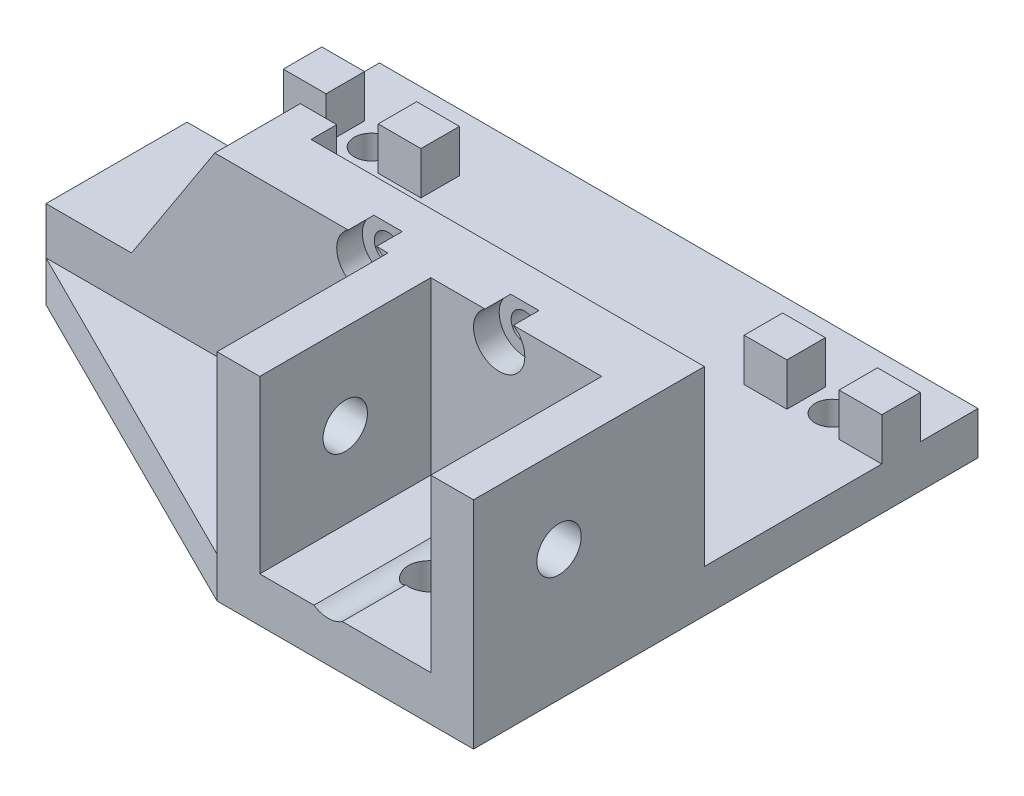
from build123d import *

# Parameters (mm, degrees)
SKETCH1_W            = 40
SKETCH1_H            = 20
SKETCH1_R            = 1.6
BOSS_EXTRUDE1_DEPTH  = 7
BOSS_EXTRUDE2_DEPTH  = 5
BOSS_EXTRUDE3_DEPTH  = 5
BOSS_EXTRUDE4_DEPTH  = 0.25
SKETCH5_W            = 50
SKETCH5_H            = 36
BOSS_EXTRUDE5_DEPTH  = 5
SKETCH6_R            = 3
CUT_EXTRUDE1_DEPTH   = 3
BOSS_EXTRUDE6_DEPTH  = 20
BOSS_EXTRUDE8_DEPTH  = 20
SKETCH10_R           = 2.6
CUT_EXTRUDE2_DEPTH   = 60.779281528
BOSS_EXTRUDE9_DEPTH  = 20
SKETCH12_R           = 2.6
CUT_EXTRUDE3_DEPTH   = 60.190898836
SKETCH13_W           = 5
SKETCH13_H           = 5
CUT_EXTRUDE4_DEPTH   = 6.5
CHAMFER1_SIZE        = 15.398649638
CHAMFER1_SIZE_2      = 10
SKETCH14_W           = 1
SKETCH14_H           = 20.25
CUT_EXTRUDE5_DEPTH   = 10
SKETCH16_W           = 4
SKETCH16_H           = 20.25
CUT_EXTRUDE7_DEPTH   = 10
BOSS_EXTRUDE10_DEPTH = 4.75
SKETCH18_W           = 70
SKETCH18_H           = 5
BOSS_EXTRUDE11_DEPTH = 3
BOSS_EXTRUDE7_DEPTH  = 5
SKETCH15_R           = 2
CUT_EXTRUDE6_DEPTH   = 10


with BuildPart() as part:
    # Sketch1 → Boss-Extrude1 (new body)
    with BuildSketch(Plane.XY):
        Rectangle(SKETCH1_W, SKETCH1_H)
        with Locations((-8, 7.5)):
            Circle(SKETCH1_R, mode=Mode.SUBTRACT)
        with Locations((8, 7.5)):
            Circle(SKETCH1_R, mode=Mode.SUBTRACT)
        with Locations((8, -7.5)):
            Circle(SKETCH1_R, mode=Mode.SUBTRACT)
        with Locations((-8, -7.5)):
            Circle(SKETCH1_R, mode=Mode.SUBTRACT)
    extrude(amount=BOSS_EXTRUDE1_DEPTH)

    # Sketch2 → Boss-Extrude2 (add)
    with BuildSketch(Plane(origin=(20, 0, 0), x_dir=(0, 0, -1), z_dir=(1, 0, 0))):
        Polygon((3, -5), (3, 5), (9.5, 5), (9.5, 10), (0, 10), (-7, 10), (-7, -10), (0, -10), (9.5, -10), (9.5, -5), align=None)
    extrude(amount=BOSS_EXTRUDE2_DEPTH)

    # Sketch3 → Boss-Extrude3 (add)
    with BuildSketch(Plane.ZY.offset(20)):
        Polygon((7, 10), (-9.5, 10), (-9.5, 5), (-3, 5), (-3, -5), (-9.5, -5), (-9.5, -10), (7, -10), align=None)
    extrude(amount=BOSS_EXTRUDE3_DEPTH)

    # Sketch4 → Boss-Extrude4 (add)
    with BuildSketch(Plane.XZ.offset(10)):
        Polygon((-25, 7), (-25, -9.5), (-20, -9.5), (-20, 0), (20, 0), (20, -9.5), (25, -9.5), (25, 7), align=None)
    extrude(amount=BOSS_EXTRUDE4_DEPTH)

    # Sketch5 → Boss-Extrude5 (add)
    with BuildSketch(Plane.XZ.offset(10.25)):
        with Locations((0, -11)):
            Rectangle(SKETCH5_W, SKETCH5_H)
    extrude(amount=BOSS_EXTRUDE5_DEPTH)

    # Sketch6 → Cut-Extrude1 (cut)
    with BuildSketch(Plane.XY.offset(7)):
        with Locations((-8, 7.5)):
            Circle(SKETCH6_R)
        with Locations((-8, -7.5)):
            Circle(SKETCH6_R)
        with Locations((8, -7.5)):
            Circle(SKETCH6_R)
        with Locations((8, 7.5)):
            Circle(SKETCH6_R)
    extrude(amount=-CUT_EXTRUDE1_DEPTH, mode=Mode.SUBTRACT)

    # Sketch7 → Boss-Extrude6 (add)
    with BuildSketch(Plane.ZY.offset(25)):
        Polygon((-3, -5), (7, -5), (7, -15.25), (-29, -15.25), (-29, -10.25), (-9.5, -10.25), (-9.5, -5), align=None)
    extrude(amount=BOSS_EXTRUDE6_DEPTH)

    # Sketch9 → Boss-Extrude8 (add)
    with BuildSketch(Plane.XY.offset(7)):
        Polygon((0, 0), (0, 10), (-5, 10), (-5, -10), (0, -10), align=None)
        Polygon((20, 0), (20, 10), (25, 10), (25, -10), (20, -10), align=None)
    extrude(amount=BOSS_EXTRUDE8_DEPTH)

    # Sketch10 → Cut-Extrude2 (cut, through all)
    with BuildSketch(Plane.ZY.offset(25)):
        with Locations(Location((17, 0, 0), (0, 0, 270))):
            Circle(SKETCH10_R)
    extrude(amount=-CUT_EXTRUDE2_DEPTH, mode=Mode.SUBTRACT)

    # Sketch11 → Boss-Extrude9 (add, through all)
    with BuildSketch(Plane.XY.offset(7)):
        with BuildLine():
            Line((25, -15.25), (25, -10))
            Line((25, -10), (10, -10))
            Line((10, -10), (9.658312395, -10))
            add(Edge.make_bspline(
                [(9.658312395, -10), (9.104622692, -10.372271133), (7.89971927, -10.67517784), (6.757134286, -10.276593696), (6.341687605, -10)],
                knots=[0, 0, 0, 0, 0.571533916, 1, 1, 1, 1], degree=3))
            Line((6.341687605, -10), (-5, -10))
            Line((-5, -10), (-5, -15.25))
            Line((-5, -15.25), (25, -15.25))
        make_face()
    extrude(amount=BOSS_EXTRUDE9_DEPTH)

    # Sketch12 → Cut-Extrude3 (cut, through all)
    with BuildSketch(Plane.XZ.offset(15.25)):
        with Locations(Location((10, 17, 0), (0, 0, 270))):
            Circle(SKETCH12_R)
    extrude(amount=-CUT_EXTRUDE3_DEPTH, mode=Mode.SUBTRACT)

    # Sketch13 → Cut-Extrude4 (cut)
    with BuildSketch(Plane(origin=(0, 0, -9.5), x_dir=(-1, 0, 0), z_dir=(0, 0, -1))):
        with Locations((22.5, 7.5)):
            Rectangle(SKETCH13_W, SKETCH13_H)
        with Locations((-22.5, 7.5)):
            Rectangle(SKETCH13_W, SKETCH13_H)
    extrude(amount=-CUT_EXTRUDE4_DEPTH, mode=Mode.SUBTRACT)

    # Chamfer1
    # the kernel refuses this chamfer: 15.398649638, 10 mm, written as the material it adds along each edge
    with BuildSketch(Plane(origin=(-25, -5, 7), x_dir=(0.021073765466273167, 0.9997779235455604, 0), z_dir=(0, 0, -1))) as chamfer1_piece_1_section:
        Polygon((CHAMFER1_SIZE * 0.999777923555, -CHAMFER1_SIZE * 0.0210737654665), (-CHAMFER1_SIZE_2 * 0.0210737654663, -CHAMFER1_SIZE_2 * 0.999777923546), (0, 0), align=None)
    chamfer1_piece_1 = extrude(amount=10, mode=Mode.PRIVATE)
    chamfer1_piece_1 = split(chamfer1_piece_1, bisect_by=Plane(origin=(-28.252881362, 10, 2), z_dir=(0, -1, 0)), keep=Keep.TOP, mode=Mode.PRIVATE)
    add(chamfer1_piece_1)

    # Sketch14 → Cut-Extrude5 (cut)
    with BuildSketch(Plane(origin=(0, 0, 0), x_dir=(-1, 0, 0), z_dir=(0, 0, -1))):
        with Locations((20.5, -0.125)):
            Rectangle(SKETCH14_W, SKETCH14_H)
        with Locations((-20.5, -0.125)):
            Rectangle(SKETCH14_W, SKETCH14_H)
    extrude(amount=CUT_EXTRUDE5_DEPTH, mode=Mode.SUBTRACT)

    # Sketch16 → Cut-Extrude7 (cut)
    with BuildSketch(Plane(origin=(0, 0, 0), x_dir=(-1, 0, 0), z_dir=(0, 0, -1))):
        with Locations((-23, -0.125)):
            Rectangle(SKETCH16_W, SKETCH16_H)
    extrude(amount=CUT_EXTRUDE7_DEPTH, mode=Mode.SUBTRACT)

    # Sketch17 → Boss-Extrude10 (add)
    with BuildSketch(Plane.XZ.offset(15.25)):
        Polygon((-5, 27), (-45, 7), (-5, 7), align=None)
    extrude(amount=-BOSS_EXTRUDE10_DEPTH)

    # Sketch18 → Boss-Extrude11 (add)
    with BuildSketch(Plane(origin=(0, 0, -29), x_dir=(-1, 0, 0), z_dir=(0, 0, -1))):
        with Locations((10, -12.75)):
            Rectangle(SKETCH18_W, SKETCH18_H)
    extrude(amount=BOSS_EXTRUDE11_DEPTH)

    # Sketch8 → Boss-Extrude7 (add)
    with BuildSketch(Plane(origin=(0, -10.25, 0), x_dir=(1, 0, 0), z_dir=(0, 1, 0))):
        Polygon((20, 20.75), (20, 25.25), (25, 25.25), (25, 20.75), (22, 20.75), align=None)
        Polygon((13.9, 23), (13.9, 20.75), (11.9, 20.75), (8.9, 20.75), (8.9, 25.25), (13.9, 25.25), align=None)
        Polygon((-28.9, 20.75), (-28.9, 25.25), (-33.9, 25.25), (-33.9, 23), (-33.9, 20.75), (-31.9, 20.75), align=None)
        Polygon((-45, 20.75), (-42, 20.75), (-40, 20.75), (-40, 25.25), (-45, 25.25), align=None)
    extrude(amount=BOSS_EXTRUDE7_DEPTH)

    # Sketch15 → Cut-Extrude6 (cut)
    with BuildSketch(Plane(origin=(0, -10.25, 0), x_dir=(1, 0, 0), z_dir=(0, 1, 0))):
        with Locations(Location((16.95, 23, 0), (0, 0, 270))):
            Circle(SKETCH15_R)
        with Locations(Location((-36.95, 23, 0), (0, 0, 270))):
            Circle(SKETCH15_R)
    extrude(amount=-CUT_EXTRUDE6_DEPTH, mode=Mode.SUBTRACT)


solid = part.part
